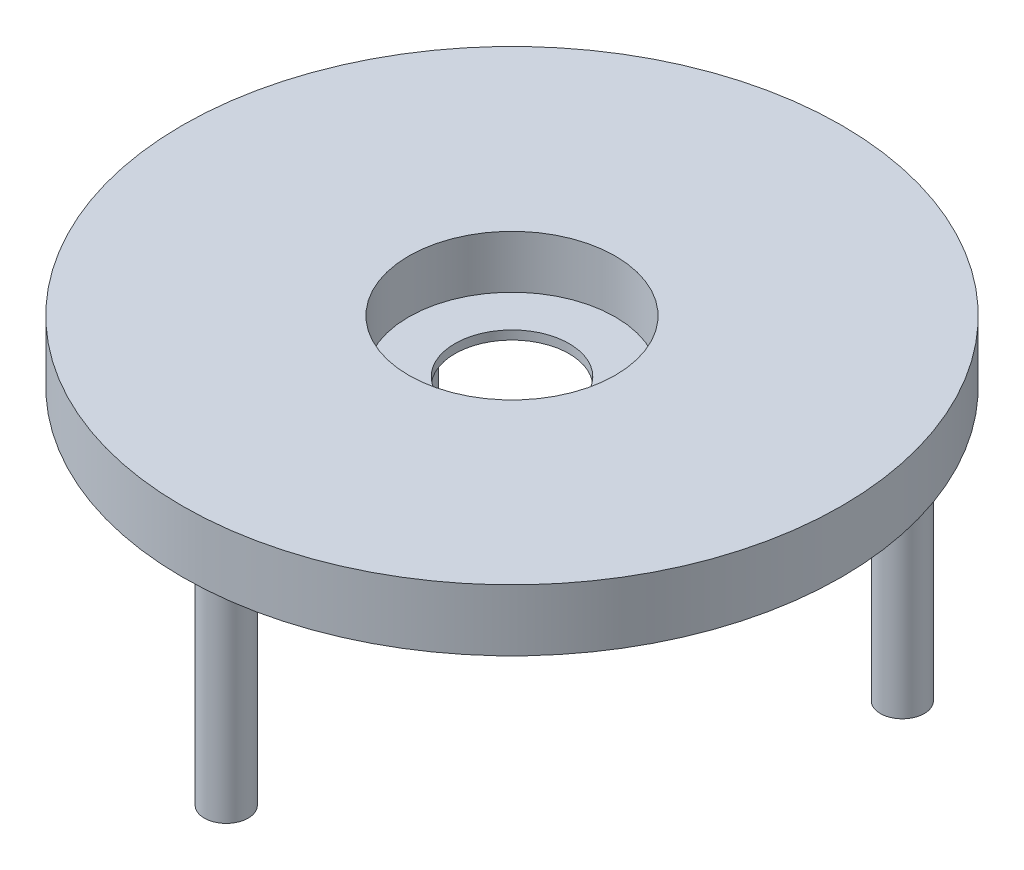
from build123d import *

# Parameters (mm, degrees)
SZKIC4_R                    = 75
DODANIE_WYCI_GNI_CIE2_DEPTH = 14
SZKIC5_R                    = 23.5
WYTNIJ_WYCI_GNI_CIE3_DEPTH  = 12
SZKIC6_R                    = 13
WYTNIJ_WYCI_GNI_CIE4_DEPTH  = 12
SZKIC7_R                    = 5
DODANIE_WYCI_GNI_CIE3_DEPTH = 50


with BuildPart() as part:
    # Szkic4 → Dodanie-wyciągnięcie2 (new body)
    with BuildSketch(Plane(origin=(0, 0, 0), x_dir=(1, 0, 0), z_dir=(0, 1, 0))):
        Circle(SZKIC4_R)
    extrude(amount=DODANIE_WYCI_GNI_CIE2_DEPTH)

    # Szkic5 → Wytnij-wyciągnięcie3 (cut)
    with BuildSketch(Plane(origin=(0, 14, 0), x_dir=(1, 0, 0), z_dir=(0, 1, 0))):
        Circle(SZKIC5_R)
    extrude(amount=-WYTNIJ_WYCI_GNI_CIE3_DEPTH, mode=Mode.SUBTRACT)

    # Szkic6 → Wytnij-wyciągnięcie4 (cut)
    with BuildSketch(Plane(origin=(0, 2, 0), x_dir=(1, 0, 0), z_dir=(0, 1, 0))):
        Circle(SZKIC6_R)
    extrude(amount=-WYTNIJ_WYCI_GNI_CIE4_DEPTH, mode=Mode.SUBTRACT)

    # Szkic7 → Dodanie-wyciągnięcie3 (add)
    with BuildSketch(Plane(origin=(0, 0, 0), x_dir=(-1, 0, 0), z_dir=(0, -1, 0))):
        with Locations((0, -65)):
            Circle(SZKIC7_R)
        with Locations((-56.291651246, 32.5)):
            Circle(SZKIC7_R)
        with Locations((56.291651246, 32.5)):
            Circle(SZKIC7_R)
    extrude(amount=DODANIE_WYCI_GNI_CIE3_DEPTH)


solid = part.part
